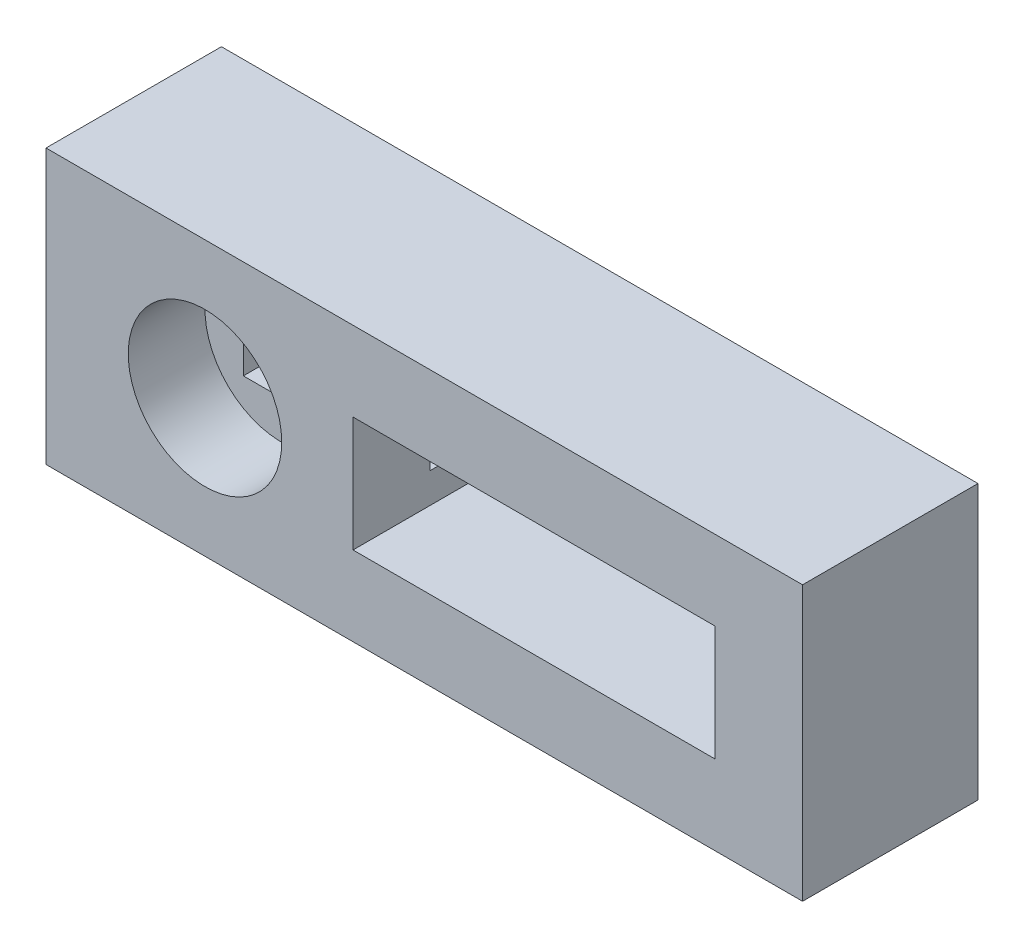
from build123d import *

# Parameters (mm, degrees)
SKIZZE1_W                       = 69
SKIZZE1_H                       = 25
AUFSATZ_LINEAR_AUSTRAGEN1_DEPTH = 16
SKIZZE2_R                       = 7
SCHNITT_LINEAR_AUSTRAGEN1_DEPTH = 7
SKIZZE3_W                       = 7
SKIZZE3_H                       = 7
SCHNITT_LINEAR_AUSTRAGEN2_DEPTH = 2
SKIZZE5_W                       = 13
SKIZZE5_H                       = 13
SCHNITT_LINEAR_AUSTRAGEN3_DEPTH = 8
SKIZZE6_W                       = 33
SKIZZE6_H                       = 10.5
SCHNITT_LINEAR_AUSTRAGEN4_DEPTH = 16
SKIZZE7_W                       = 5
SKIZZE7_H                       = 5
SCHNITT_LINEAR_AUSTRAGEN5_DEPTH = 9
SKIZZE9_R                       = 0.75
SCHNITT_LINEAR_AUSTRAGEN6_DEPTH = 5


with BuildPart() as part:
    # Skizze1 → Aufsatz-Linear austragen1 (new body)
    with BuildSketch(Plane.XY):
        with Locations((-34.5, 0)):
            Rectangle(SKIZZE1_W, SKIZZE1_H)
    extrude(amount=AUFSATZ_LINEAR_AUSTRAGEN1_DEPTH)

    # Skizze2 → Schnitt-Linear austragen1 (cut)
    with BuildSketch(Plane.XY.offset(16)):
        with Locations((-54.5, 0)):
            Circle(SKIZZE2_R)
    extrude(amount=-SCHNITT_LINEAR_AUSTRAGEN1_DEPTH, mode=Mode.SUBTRACT)

    # Skizze3 → Schnitt-Linear austragen2 (cut)
    with BuildSketch(Plane.XY.offset(9)):
        with Locations((-54.5, 0)):
            Rectangle(SKIZZE3_W, SKIZZE3_H)
    extrude(amount=-SCHNITT_LINEAR_AUSTRAGEN2_DEPTH, mode=Mode.SUBTRACT)

    # Skizze5 → Schnitt-Linear austragen3 (cut)
    with BuildSketch(Plane.XY.offset(7)):
        with Locations((-54.5, 0)):
            Rectangle(SKIZZE5_W, SKIZZE5_H)
    extrude(amount=-SCHNITT_LINEAR_AUSTRAGEN3_DEPTH, mode=Mode.SUBTRACT)

    # Skizze6 → Schnitt-Linear austragen4 (cut)
    with BuildSketch(Plane(origin=(0, 0, 0), x_dir=(-1, 0, 0), z_dir=(0, 0, -1))):
        with Locations((24.5, 0)):
            Rectangle(SKIZZE6_W, SKIZZE6_H)
    extrude(amount=-SCHNITT_LINEAR_AUSTRAGEN4_DEPTH, mode=Mode.SUBTRACT)

    # Skizze7 → Schnitt-Linear austragen5 (cut)
    with BuildSketch(Plane(origin=(0, 0, 0), x_dir=(-1, 0, 0), z_dir=(0, 0, -1))):
        with Locations((43.5, 0)):
            Rectangle(SKIZZE7_W, SKIZZE7_H)
        with Locations((5.5, 0)):
            Rectangle(SKIZZE7_W, SKIZZE7_H)
    extrude(amount=-SCHNITT_LINEAR_AUSTRAGEN5_DEPTH, mode=Mode.SUBTRACT)

    # Skizze9 → Schnitt-Linear austragen6 (cut)
    with BuildSketch(Plane(origin=(0, 0, 9), x_dir=(-1, 0, 0), z_dir=(0, 0, -1))):
        with Locations((43.5, 0)):
            Circle(SKIZZE9_R)
        with Locations((5.5, 0)):
            Circle(SKIZZE9_R)
    extrude(amount=-SCHNITT_LINEAR_AUSTRAGEN6_DEPTH, mode=Mode.SUBTRACT)


solid = part.part
